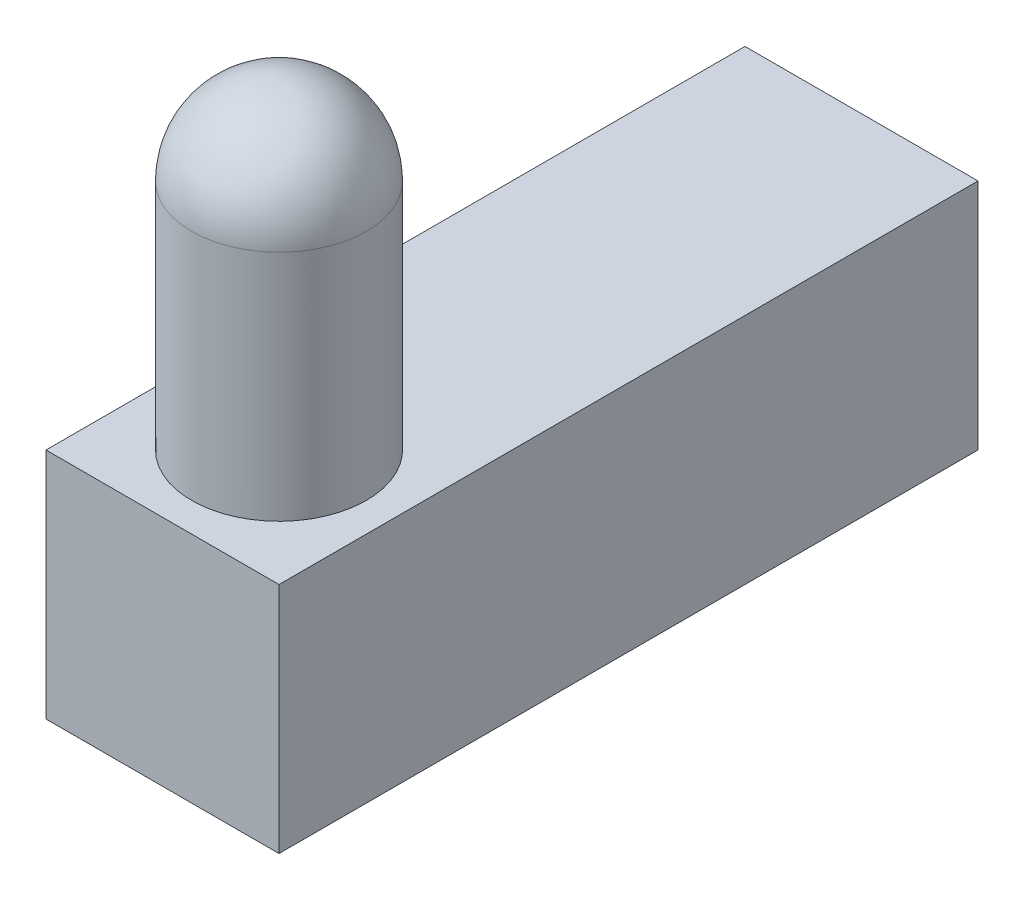
from build123d import *

# Parameters (mm, degrees)
SKETCH1_W           = 101.6
SKETCH1_H           = 304.8
BOSS_EXTRUDE1_DEPTH = 101.6
SKETCH2_R           = 38.1
BOSS_EXTRUDE2_DEPTH = 101.6


with BuildPart() as part:
    # Sketch1 → Boss-Extrude1 (new body)
    with BuildSketch(Plane(origin=(0, 0, 0), x_dir=(1, 0, 0), z_dir=(0, 1, 0))):
        with Locations((50.8, 152.4)):
            Rectangle(SKETCH1_W, SKETCH1_H)
    extrude(amount=BOSS_EXTRUDE1_DEPTH)

    # Sketch2 → Boss-Extrude2 (add)
    with BuildSketch(Plane(origin=(0, 101.6, 0), x_dir=(1, 0, 0), z_dir=(0, 1, 0))):
        with Locations((50.8, 50.8)):
            Circle(SKETCH2_R)
    extrude(amount=BOSS_EXTRUDE2_DEPTH)


with BuildPart() as revolve3_tool:
    # Sketch5 → Revolve3 (revolve)
    with BuildSketch(Plane(origin=(0, 203.2, 0), x_dir=(1, 0, 0), z_dir=(0, 1, 0))):
        with BuildLine():
            Line((88.773190278, 53.905933046), (12.826809722, 47.694066954))
            ThreePointArc((12.826809722, 47.694066954), (47.694066954, 88.773190278), (88.773190278, 53.905933046))
        make_face()
    revolve(axis=Axis((88.773190278, 203.2, -53.905933046), (-0.9966716608485279, 0, 0.08152055238672798)))


with BuildPart() as part_1:
    add(part.part)


with BuildPart() as part_2:
    # Revolve3: joined with revolve3_tool
    add(part_1.part.fuse(revolve3_tool.part, tol=0.00001))


solid = part_2.part
